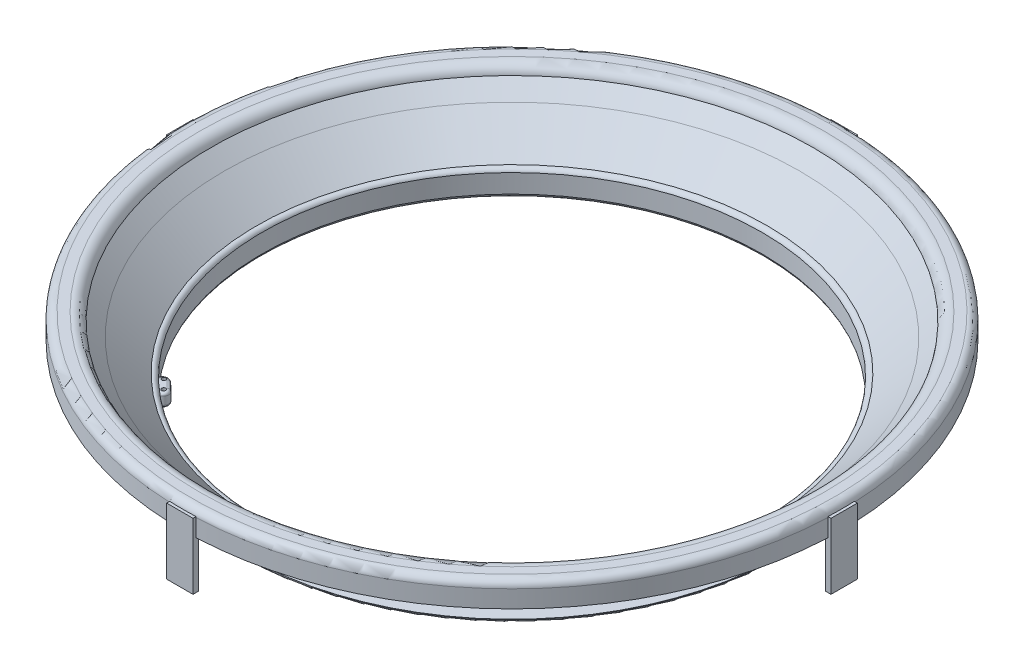
from build123d import *

# Parameters (mm, degrees)
FILLET2_R           = 0.2
BOSS_EXTRUDE1_DEPTH = 1
SKETCH4_R           = 0.153213077
CUT_EXTRUDE1_DEPTH  = 1
FILLET4_R           = 0.2
FILLET5_R           = 0.2
SKETCH5_W           = 0.4
SKETCH5_H           = 2
SKETCH5_W_2         = 2
SKETCH5_H_2         = 0.4
BOSS_EXTRUDE2_DEPTH = 5


with BuildPart() as part:
    # Sketch1 → Revolve1 (revolve)
    with BuildSketch(Plane.XY, mode=Mode.PRIVATE) as revolve1_sk:
        with BuildLine():
            Line((-25.233953941, 4.384216192), (-25.233953941, 4.725701731))
            ThreePointArc((-25.233953941, 4.725701731), (-25.059314561, 5.112459467), (-24.662346854, 5.262449795))
            Line((-24.662346854, 5.262449795), (-24.493245747, 5.262449795))
            Line((-24.493245747, 5.262449795), (-24.493245747, 4.70827222))
            Line((-24.493245747, 4.70827222), (-24.111678282, 4.70827222))
            Line((-24.111678282, 4.70827222), (-24.111678282, 5.259425594))
            ThreePointArc((-24.111678282, 5.259425594), (-23.69503915, 5.040700049), (-23.48706953, 4.618589084))
            Line((-23.48706953, 4.618589084), (-22.461764697, 3.593284251))
            ThreePointArc((-22.461764697, 3.593284251), (-22.457381436, 3.48513382), (-22.377808098, 3.411759351))
            Line((-22.377808098, 3.411759351), (-21.256297739, 2.361574277))
            ThreePointArc((-21.256297739, 2.361574277), (-21.173608491, 2.291730044), (-21.065751032, 2.300812841))
            Line((-21.065751032, 2.300812841), (-19.997967278, 1.233029087))
            ThreePointArc((-19.997967278, 1.233029087), (-19.771487823, 1.160800435), (-19.662416034, 0.949581906))
            Line((-19.662416034, 0.949581906), (-19.662416034, 0.183936837))
            ThreePointArc((-19.662416034, 0.183936837), (-19.665266569, -0.072597654), (-19.848679479, -0.251979299))
            Line((-19.848679479, -0.251979299), (-20.951952139, -0.251979299))
            Line((-20.951952139, -0.251979299), (-20.949700564, -0.486081866))
            Line((-20.949700564, -0.486081866), (-19.72102527, -0.486081866))
            ThreePointArc((-19.72102527, -0.486081866), (-19.541832723, -0.38586655), (-19.438422729, -0.208498425))
            Line((-19.438422729, -0.208498425), (-19.438422729, 1.205918216))
            ThreePointArc((-19.438422729, 1.205918216), (-19.585253007, 1.407550081), (-19.831215203, 1.448988446))
            Line((-19.831215203, 1.448988446), (-22.295012621, 3.80924361))
            Line((-22.295012621, 3.80924361), (-23.320317454, 4.834548442))
            ThreePointArc((-23.320317454, 4.834548442), (-23.61718796, 5.334681104), (-24.180754305, 5.478409153))
            Line((-24.180754305, 5.478409153), (-24.880754305, 5.478409153))
            ThreePointArc((-24.880754305, 5.478409153), (-25.287991721, 5.333133477), (-25.470738162, 4.941277543))
            Line((-25.470738162, 4.941277543), (-25.470738162, 3.619675417))
            Line((-25.470738162, 3.619675417), (-25.233953941, 3.619675417))
            Line((-25.233953941, 3.619675417), (-25.233953941, 4.007317266))
            Line((-25.233953941, 4.007317266), (-24.705913954, 4.007317266))
            Line((-24.705913954, 4.007317266), (-24.705913954, 4.384216192))
            Line((-24.705913954, 4.384216192), (-25.233953941, 4.384216192))
        make_face()
    revolve(revolve1_sk.sketch.rotate(Axis((-0.470738162, -0.486081866, 0), (0, 1, 0)), 270), axis=Axis((-0.470738162, -0.486081866, 0), (0, 1, 0)))

    # Fillet2
    fillet2_edges = [part.edges().sort_by_distance(p)[0] for p in [
        (-0.470738162, -0.486081866, 20.478962402),
    ]]
    fillet(fillet2_edges, radius=FILLET2_R)

    # Sketch2 → Boss-Extrude1 (add)
    with BuildSketch(Plane(origin=(0, 0, 0), x_dir=(1, 0, 0), z_dir=(0, 1, 0))):
        with BuildLine():
            Line((-13.420434864, -12.947225659), (-12.840605954, -13.502566638))
            ThreePointArc((-12.840605954, -13.502566638), (-12.827327905, -14.11808784), (-13.442849108, -14.131365889))
            Line((-13.442849108, -14.131365889), (-14.022678018, -13.57602491))
            ThreePointArc((-14.022678018, -13.57602491), (-14.035956067, -12.960503708), (-13.420434864, -12.947225659))
        make_face()
    extrude(amount=BOSS_EXTRUDE1_DEPTH)

    # Sketch4 → Cut-Extrude1 (cut)
    with BuildSketch(Plane(origin=(0, 0, 0), x_dir=(1, 0, 0), z_dir=(0, 1, 0))):
        with Locations(Location((-13.729004141, -13.155687354, 0), (0, 0, 270))):
            Circle(SKETCH4_R)
        with Locations(Location((-13.056104047, -13.837868828, 0), (0, 0, 270))):
            Circle(SKETCH4_R)
    extrude(amount=CUT_EXTRUDE1_DEPTH, mode=Mode.SUBTRACT)

    # Fillet4
    # the kernel refuses this fillet: 0.2 mm, written as the material it takes off along each edge
    with BuildSketch(Plane(origin=(-13.141727531, 1, 13.816966263), x_dir=(0.6916921229357414, 0, -0.7221925000085828), z_dir=(-0.7221925000085828, 0, -0.6916921229357414))) as fillet4_piece_1_section:
        with BuildLine():
            CenterArc((0.435340474 - FILLET4_R, FILLET4_R), FILLET4_R, 270, 90)
            Line((0.435340474 - FILLET4_R, 0), (0.435340474, 0))
            Line((0.435340474, 0), (0.435340474, FILLET4_R))
        make_face()
    fillet4_piece_1 = revolve(axis=Axis((-13.141727531, 1, 13.816966263), (0, -1, 0)), revolution_arc=184.446236996, mode=Mode.PRIVATE)
    fillet4_piece_1 = fillet4_piece_1 & Plane(origin=(-0.470738162, 0.94286612, 0), x_dir=(0, 0, -1), z_dir=(0, 1, 0)) * Cylinder(18.967684567, 2, mode=Mode.PRIVATE)
    add(fillet4_piece_1, mode=Mode.SUBTRACT)
    with BuildSketch(Plane(origin=(-13.420434864, 1, 12.947225659), x_dir=(-0.6916921229357023, 0, 0.7221925000086206), z_dir=(0.7221925000086207, 0, 0.6916921229357023))) as fillet4_piece_2:
        with BuildLine():
            CenterArc((FILLET4_R, FILLET4_R), FILLET4_R, 180, 90)
            Line((0, FILLET4_R), (0, 0))
            Line((0, 0), (FILLET4_R, 0))
        make_face()
    extrude(amount=0.802873071, mode=Mode.SUBTRACT)
    with BuildSketch(Plane(origin=(-13.721556441, 1, 13.261625285), x_dir=(-0.6328078116137835, 0, 0.7743089006078739), z_dir=(0.7743089006078739, 0, 0.6328078116137835))) as fillet4_piece_3_section:
        with BuildLine():
            CenterArc((0.435340474 - FILLET4_R, FILLET4_R), FILLET4_R, 270, 90)
            Line((0.435340474, FILLET4_R), (0.435340474, 0))
            Line((0.435340474, 0), (0.435340474 - FILLET4_R, 0))
        make_face()
    fillet4_piece_3 = revolve(axis=Axis((-13.721556441, 1, 13.261625285), (0, -1, 0)), revolution_arc=184.506621836, mode=Mode.PRIVATE)
    fillet4_piece_3 = fillet4_piece_3 & Plane(origin=(-0.470738162, 0.94286638, 0), x_dir=(0, 0, -1), z_dir=(0, 1, 0)) * Cylinder(18.967684567, 2, mode=Mode.PRIVATE)
    add(fillet4_piece_3, mode=Mode.SUBTRACT)

    # Fillet5
    # the kernel refuses this fillet: 0.2 mm, written as the material it takes off along each edge
    with BuildSketch(Plane(origin=(-13.721556441, 0, 13.261625285), x_dir=(-0.6328078116137835, 0, 0.7743089006078739), z_dir=(0.7743089006078739, 0, 0.6328078116137835))) as fillet5_piece_1_section:
        with BuildLine():
            CenterArc((0.435340474 - FILLET5_R, -FILLET5_R), FILLET5_R, 0, 90)
            Line((0.435340474, -FILLET5_R), (0.435340474, 0))
            Line((0.435340474, 0), (0.435340474 - FILLET5_R, 0))
        make_face()
    fillet5_piece_1 = revolve(axis=Axis((-13.721556441, 0, 13.261625285), (0, -1, 0)), revolution_arc=184.506621836, mode=Mode.PRIVATE)
    fillet5_piece_1 = fillet5_piece_1 & Plane(origin=(-0.470738162, 0.057214197, 0), x_dir=(0, 0, -1), z_dir=(0, 1, 0)) * Cylinder(18.967684567, 2, mode=Mode.PRIVATE)
    add(fillet5_piece_1, mode=Mode.SUBTRACT)
    with BuildSketch(Plane(origin=(-13.141727531, 0, 13.816966263), x_dir=(0.6916921229357414, 0, -0.7221925000085828), z_dir=(-0.7221925000085828, 0, -0.6916921229357414))) as fillet5_piece_2_section:
        with BuildLine():
            CenterArc((0.435340474 - FILLET5_R, -FILLET5_R), FILLET5_R, 0, 90)
            Line((0.435340474 - FILLET5_R, 0), (0.435340474, 0))
            Line((0.435340474, 0), (0.435340474, -FILLET5_R))
        make_face()
    fillet5_piece_2 = revolve(axis=Axis((-13.141727531, 0, 13.816966263), (0, -1, 0)), revolution_arc=184.446236996, mode=Mode.PRIVATE)
    fillet5_piece_2 = fillet5_piece_2 & Plane(origin=(-0.470738162, 0.057214353, 0), x_dir=(0, 0, -1), z_dir=(0, 1, 0)) * Cylinder(18.967684567, 2, mode=Mode.PRIVATE)
    add(fillet5_piece_2, mode=Mode.SUBTRACT)
    with BuildSketch(Plane(origin=(-13.420434864, 0, 12.947225659), x_dir=(-0.6916921229357023, 0, 0.7221925000086206), z_dir=(0.7221925000086207, 0, 0.6916921229357023))) as fillet5_piece_3:
        with BuildLine():
            CenterArc((FILLET5_R, -FILLET5_R), FILLET5_R, 90, 90)
            Line((0, -FILLET5_R), (0, 0))
            Line((0, 0), (FILLET5_R, 0))
        make_face()
    extrude(amount=0.802873071, mode=Mode.SUBTRACT)

    # Sketch5 → Boss-Extrude2 (add)
    with BuildSketch(Plane(origin=(0, 0, 0), x_dir=(1, 0, 0), z_dir=(0, 1, 0))):
        with Locations((-25.470738162, 0)):
            Rectangle(SKETCH5_W, SKETCH5_H)
        with Locations((-0.470738162, -25)):
            Rectangle(SKETCH5_W_2, SKETCH5_H_2)
        with Locations((24.529261838, 0)):
            Rectangle(SKETCH5_W, SKETCH5_H)
        with Locations((-0.470738162, 25)):
            Rectangle(SKETCH5_W_2, SKETCH5_H_2)
    extrude(amount=BOSS_EXTRUDE2_DEPTH)


solid = part.part
